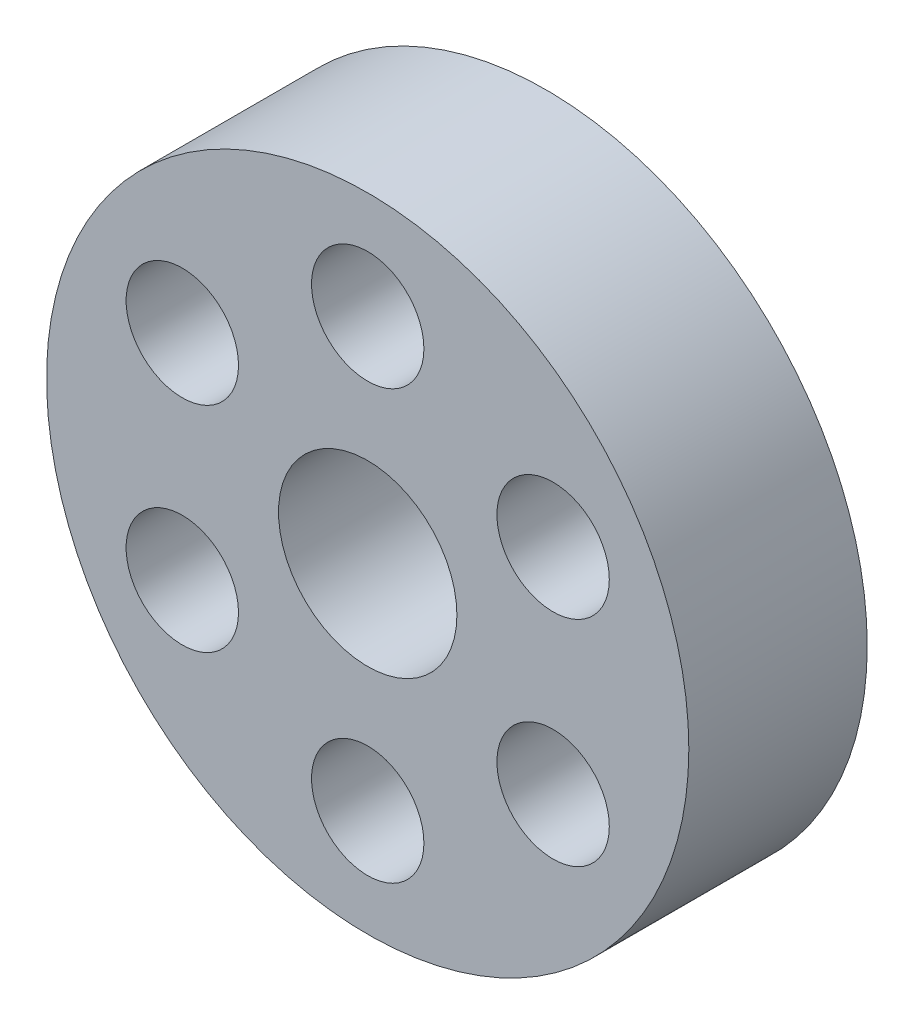
from build123d import *

# Parameters (mm, degrees)
SKETCH1_R             = 11.43
SKETCH1_R_2           = 3.175
BOSS_EXTRUDE1_DEPTH   = 6.35
F_4_0MM_DOWEL_HOLE2_D = 4
CIRPATTERN1_COUNT     = 6


with BuildPart() as part:
    # Sketch1 → Boss-Extrude1 (new body)
    with BuildSketch(Plane.XY):
        Circle(SKETCH1_R)
        Circle(SKETCH1_R_2, mode=Mode.SUBTRACT)
    extrude(amount=BOSS_EXTRUDE1_DEPTH)

    # Ø4.0mm Dowel Hole2 (through all)
    with Locations(Plane.XY.offset(6.35)):
        with Locations((0, 7.62)):
            f_4_0mm_dowel_hole2 = Hole(F_4_0MM_DOWEL_HOLE2_D / 2)

    # CirPattern1: Ø4.0mm Dowel Hole2 ×6 about axis
    cirpattern1_axis = Axis((0, 0, 6.35), (0, 0, -1))
    for i in range(1, CIRPATTERN1_COUNT):
        add(f_4_0mm_dowel_hole2.rotate(cirpattern1_axis, i * 360 / CIRPATTERN1_COUNT), mode=Mode.SUBTRACT)


solid = part.part
